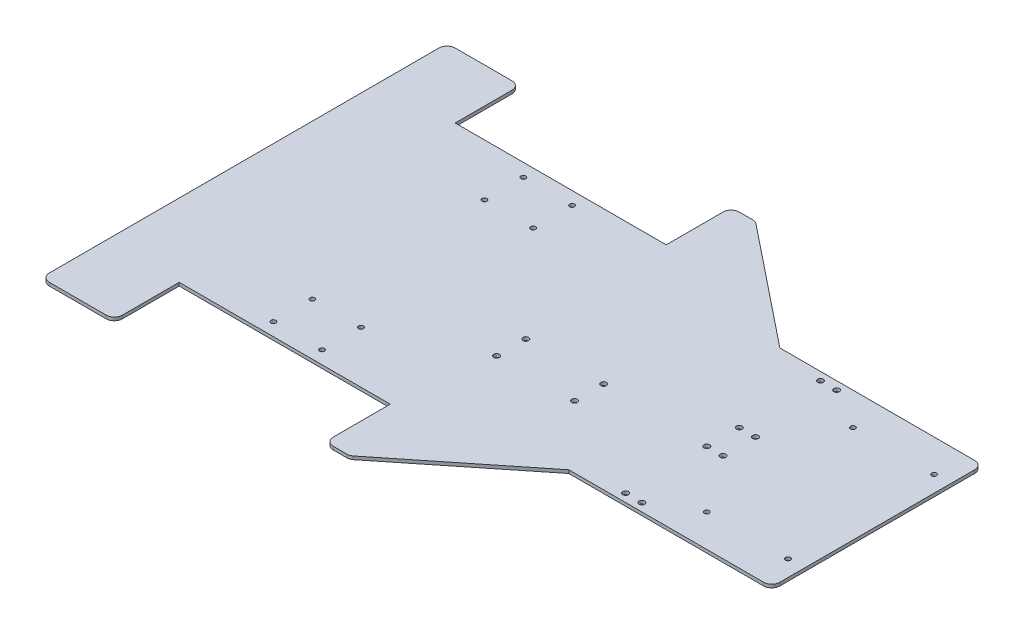
from build123d import *

# Parameters (mm, degrees)
SKETCH_1_W          = 390
SKETCH_1_H          = 250
EXTRUDE_1_DEPTH     = 2
SKETCH_2_W          = 130
SKETCH_2_H          = 40
SKETCH_2_W_2        = 125
SKETCH_2_H_2        = 60
CUT_EXTRUDE_1_DEPTH = 5
CUT_EXTRUDE_2_DEPTH = 10
FILLET_1_R          = 5
SKETCH_4_R          = 1.5
SKETCH_4_R_2        = 1.75
CUT_EXTRUDE_3_DEPTH = 232.633330935
SKETCH_5_R          = 1.75
CUT_EXTRUDE_4_DEPTH = 232.633330935
SKETCH_6_R          = 1.5
CUT_EXTRUDE_5_DEPTH = 232.633330935


with BuildPart() as part:
    # 스케치1 → 보스-돌출1 (new body)
    with BuildSketch(Plane(origin=(0, 0, 0), x_dir=(1, 0, 0), z_dir=(0, 1, 0))):
        Rectangle(SKETCH_1_W, SKETCH_1_H)
    extrude(amount=EXTRUDE_1_DEPTH)

    # 스케치2 → 컷-돌출1 (cut)
    with BuildSketch(Plane(origin=(0, 2, 0), x_dir=(1, 0, 0), z_dir=(0, 1, 0))):
        with Locations((-85, 105)):
            Rectangle(SKETCH_2_W, SKETCH_2_H)
        with Locations((-85, -105)):
            Rectangle(SKETCH_2_W, SKETCH_2_H)
        with Locations((132.5, 95)):
            Rectangle(SKETCH_2_W_2, SKETCH_2_H_2)
        with Locations((132.5, -95)):
            Rectangle(SKETCH_2_W_2, SKETCH_2_H_2)
    extrude(amount=-CUT_EXTRUDE_1_DEPTH, mode=Mode.SUBTRACT)

    # 스케치3 → 컷-돌출2 (cut)
    with BuildSketch(Plane(origin=(0, 2, 0), x_dir=(1, 0, 0), z_dir=(0, 1, 0))):
        Polygon((-5, 125), (70, 65), (70, 125), align=None)
        Polygon((70, -65), (-5, -125), (70, -125), align=None)
    extrude(amount=-CUT_EXTRUDE_2_DEPTH, mode=Mode.SUBTRACT)

    # 필렛1
    fillet_1_edges = [part.edges().sort_by_distance(p)[0] for p in [
        (-20, 1, 125),
        (-20, 1, -125),
        (-5, 1, 125),
        (-5, 1, -125),
        (195, 1, -65),
        (195, 1, 65),
        (-195, 1, -125),
        (-195, 1, 125),
        (-150, 1, -125),
        (-150, 1, 125),
    ]]
    fillet(fillet_1_edges, radius=FILLET_1_R)

    # 스케치4 → 컷-돌출3 (cut, through all)
    with BuildSketch(Plane(origin=(0, 2, 0), x_dir=(1, 0, 0), z_dir=(0, 1, 0))):
        with Locations((-100, 77)):
            Circle(SKETCH_4_R)
        with Locations((-70, 77)):
            Circle(SKETCH_4_R)
        with Locations((-70, 53)):
            Circle(SKETCH_4_R)
        with Locations((-100, 53)):
            Circle(SKETCH_4_R)
        with Locations((-100, -53)):
            Circle(SKETCH_4_R)
        with Locations((-70, -53)):
            Circle(SKETCH_4_R)
        with Locations((-70, -77)):
            Circle(SKETCH_4_R)
        with Locations((-100, -77)):
            Circle(SKETCH_4_R)
        with Locations((100, 60)):
            Circle(SKETCH_4_R_2)
        with Locations((110, 60)):
            Circle(SKETCH_4_R_2)
        with Locations((100, 10)):
            Circle(SKETCH_4_R_2)
        with Locations((110, 10)):
            Circle(SKETCH_4_R_2)
        with Locations((100, -10)):
            Circle(SKETCH_4_R_2)
        with Locations((110, -10)):
            Circle(SKETCH_4_R_2)
        with Locations((100, -60)):
            Circle(SKETCH_4_R_2)
        with Locations((110, -60)):
            Circle(SKETCH_4_R_2)
    extrude(amount=-CUT_EXTRUDE_3_DEPTH, mode=Mode.SUBTRACT)

    # 스케치5 → 컷-돌출4 (cut, through all)
    with BuildSketch(Plane(origin=(0, 2, 0), x_dir=(1, 0, 0), z_dir=(0, 1, 0))):
        with Locations((-13, -8.5)):
            Circle(SKETCH_5_R)
        with Locations((35, -8.5)):
            Circle(SKETCH_5_R)
        with Locations((-13, -26.5)):
            Circle(SKETCH_5_R)
        with Locations((35, -26.5)):
            Circle(SKETCH_5_R)
    extrude(amount=-CUT_EXTRUDE_4_DEPTH, mode=Mode.SUBTRACT)

    # 스케치6 → 컷-돌출5 (cut, through all)
    with BuildSketch(Plane(origin=(0, 2, 0), x_dir=(1, 0, 0), z_dir=(0, 1, 0))):
        with Locations((135, 45)):
            Circle(SKETCH_6_R)
        with Locations((185, 45)):
            Circle(SKETCH_6_R)
        with Locations((135, -45)):
            Circle(SKETCH_6_R)
        with Locations((185, -45)):
            Circle(SKETCH_6_R)
    extrude(amount=-CUT_EXTRUDE_5_DEPTH, mode=Mode.SUBTRACT)


solid = part.part
